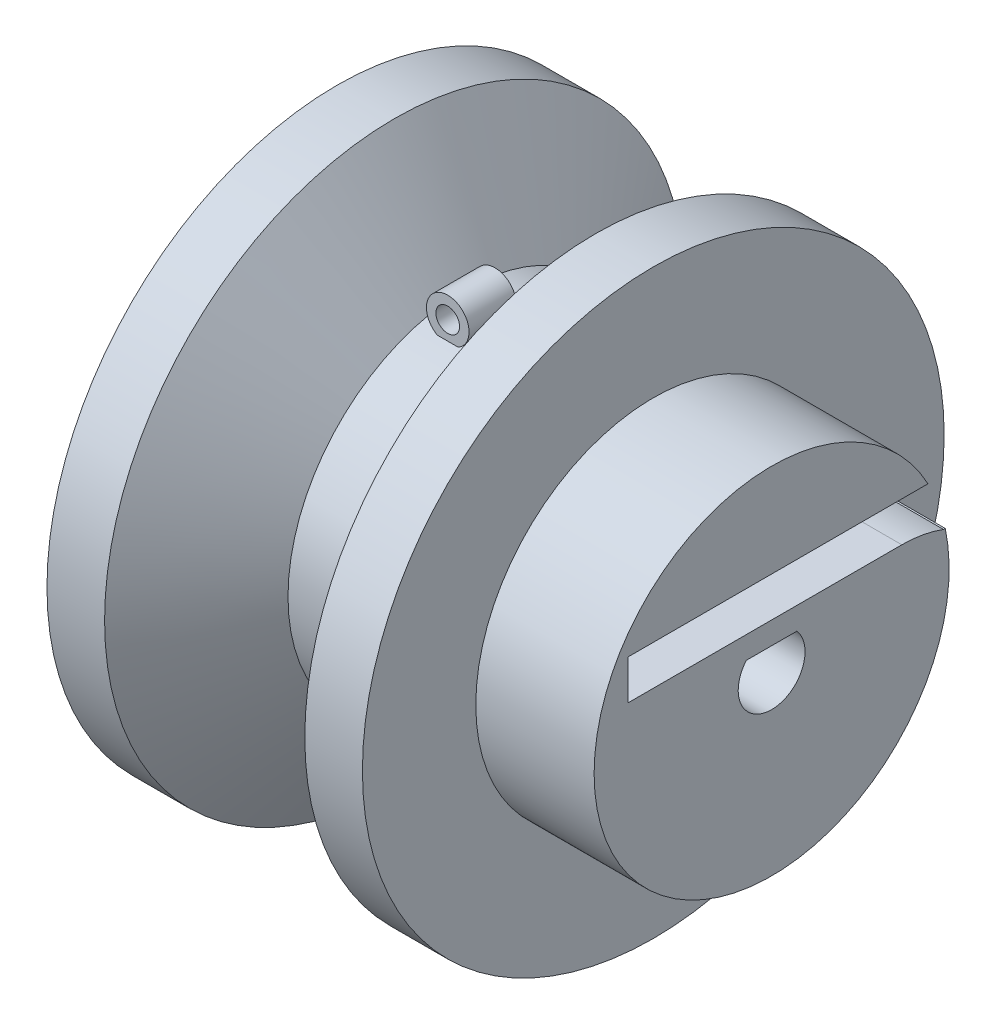
from build123d import *

# Parameters (mm, degrees)
SKETCH_3_R           = 2.825
CUT_EXTRUDE_2_DEPTH  = 35
SKETCH_16_W          = 5.008881277
SKETCH_16_H          = 1
EXTRUDE_2_DEPTH      = 30
SKETCH_19_W          = 0.959066555
SKETCH_19_H          = 0.511502163
EXTRUDE_3_DEPTH      = 30
SKETCH_24_W          = 26.827602514
SKETCH_24_H          = 4
CUT_EXTRUDE_8_DEPTH  = 9
EXTRUDE_1_DEPTH      = 2
EXTRUDE_1_DEPTH_BACK = 2
SKETCH_26_R          = 1.8
SKETCH_26_R_2        = 1
SKETCH_27_R          = 1.43
CUT_EXTRUDE_9_DEPTH  = 7
SKETCH_28_W          = 26.67763166
SKETCH_28_H          = 0.640570548
EXTRUDE_4_DEPTH      = 9
FILLET_1_R           = 10


with BuildPart() as part:
    # 草圖1 → 旋轉1 (revolve)
    with BuildSketch(Plane.XY, mode=Mode.PRIVATE) as revolve_1_sk:
        Polygon((0, 0), (0, 24.5), (4.87, 24.5), (10.87, 15), (15.87, 15), (21.87, 24.581141553), (26.74, 24.581141553), (26.74, 15), (36.74, 15), (36.74, 0), align=None)
    revolve(revolve_1_sk.sketch.rotate(Axis((-743.15639781, 0, 0), (1, 0, 0)), 90), axis=Axis((-743.15639781, 0, 0), (1, 0, 0)))

    # 草圖3 → 除料-伸長2 (cut)
    with BuildSketch(Plane(origin=(36.74, 0, 0), x_dir=(0, 0, -1), z_dir=(1, 0, 0))):
        Circle(SKETCH_3_R)
    extrude(amount=-CUT_EXTRUDE_2_DEPTH, mode=Mode.SUBTRACT)

    # 草圖16 → 填料-伸長2 (add)
    with BuildSketch(Plane(origin=(36.74, 0, 0), x_dir=(0, 0, -1), z_dir=(1, 0, 0))):
        with Locations((-0.105543204, 2.350977924)):
            Rectangle(SKETCH_16_W, SKETCH_16_H)
    extrude(amount=-EXTRUDE_2_DEPTH)

    # 草圖19 → 填料-伸長3 (add)
    with BuildSketch(Plane(origin=(36.74, 0, 0), x_dir=(0, 0, -1), z_dir=(1, 0, 0))):
        with Locations((-0.084116996, 2.673942601)):
            Rectangle(SKETCH_19_W, SKETCH_19_H)
    extrude(amount=-EXTRUDE_3_DEPTH)

    # 草圖24 → 除料-伸長8 (cut)
    with BuildSketch(Plane(origin=(36.74, 0, 0), x_dir=(0, 0, -1), z_dir=(1, 0, 0))):
        with Locations((1.262741112, 5.098242099)):
            Rectangle(SKETCH_24_W, SKETCH_24_H)
    extrude(amount=-CUT_EXTRUDE_8_DEPTH, mode=Mode.SUBTRACT)

    # 草圖26 → 伸長-薄件1 (add, two sides: drawn at the far end of the back side and taken through both)
    with BuildSketch(Plane.XY.offset(2).offset(-EXTRUDE_1_DEPTH_BACK)):
        with Locations((13.37, 16.023837481)):
            Circle(SKETCH_26_R)
        with Locations((13.37, 16.023837481)):
            Circle(SKETCH_26_R_2, mode=Mode.SUBTRACT)
    extrude(amount=EXTRUDE_1_DEPTH + EXTRUDE_1_DEPTH_BACK)

    # 草圖27 → 除料-伸長9 (cut)
    with BuildSketch(Plane(origin=(0, 12, 0), x_dir=(1, 0, 0), z_dir=(0, 1, 0))):
        with Locations(Location((31.545667046, 0, 0), (0, 0, 270))):
            Circle(SKETCH_27_R)
    extrude(amount=-CUT_EXTRUDE_9_DEPTH, mode=Mode.SUBTRACT)

    # 草圖28 → 填料-伸長4 (add)
    with BuildSketch(Plane(origin=(27.74, 0, 0), x_dir=(0, 0, -1), z_dir=(1, 0, 0))):
        with Locations((1.187755685, 3.418527373)):
            Rectangle(SKETCH_28_W, SKETCH_28_H)
    extrude(amount=EXTRUDE_4_DEPTH)

    # 圓角1
    # the kernel refuses this fillet: 10 mm, written as the material it takes off along each edge
    with BuildSketch(Plane(origin=(27.74, 3.738812647, -14.526571515), x_dir=(0, -1, 0), z_dir=(1, 0, 0))) as fillet_1_piece_1:
        with BuildLine():
            CenterArc((10, -3.521516765), FILLET_1_R, 159.381022137, 20.618977863)
            Line((0, -3.521516765), (-0.2, -3.521516765))
            Line((-0.2, -3.521516765), (-0.2, 0))
            Line((-0.2, 0), (0, 0.2))
            ThreePointArc((0, 0.2), (0.320285274, 0.2), (0.453381959, 0.070430335))
            Line((0.453381959, 0.070430335), (0.640570548, 0))
        make_face()
    extrude(amount=17.803791913, mode=Mode.SUBTRACT)


solid = part.part
